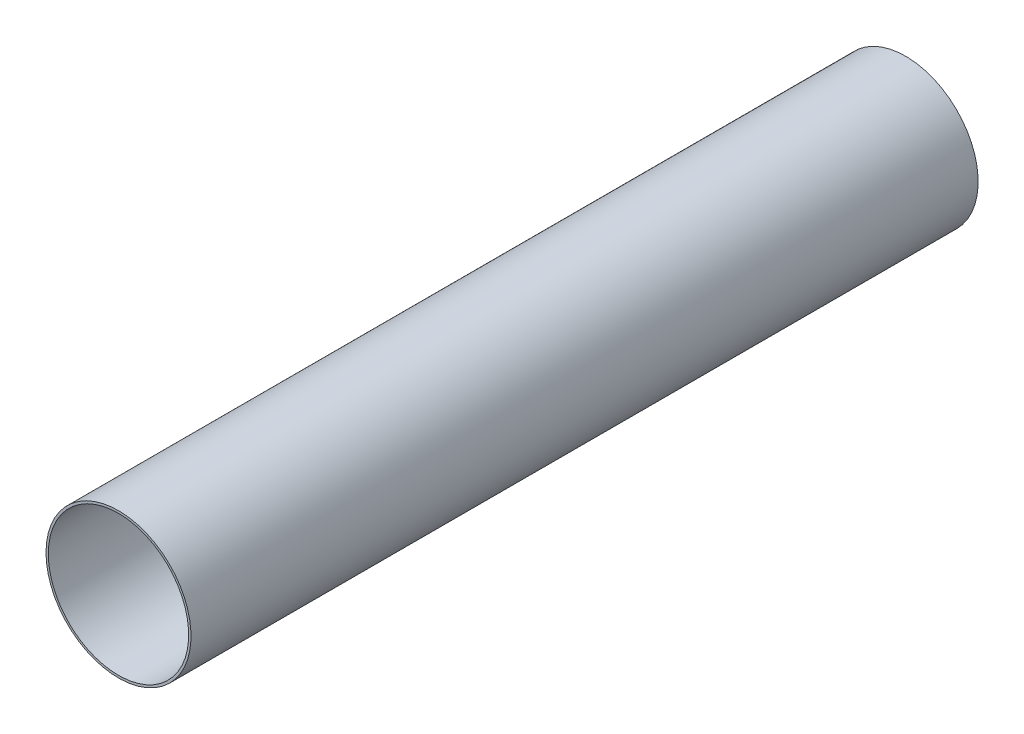
from build123d import *

# Parameters (mm, degrees)
SKETCH1_R           = 28.067
SKETCH1_R_2         = 27.178
BOSS_EXTRUDE1_DEPTH = 304.8


with BuildPart() as part:
    # Sketch1 → Boss-Extrude1 (new body)
    with BuildSketch(Plane.XY):
        Circle(SKETCH1_R)
        Circle(SKETCH1_R_2, mode=Mode.SUBTRACT)
    extrude(amount=BOSS_EXTRUDE1_DEPTH)


solid = part.part
